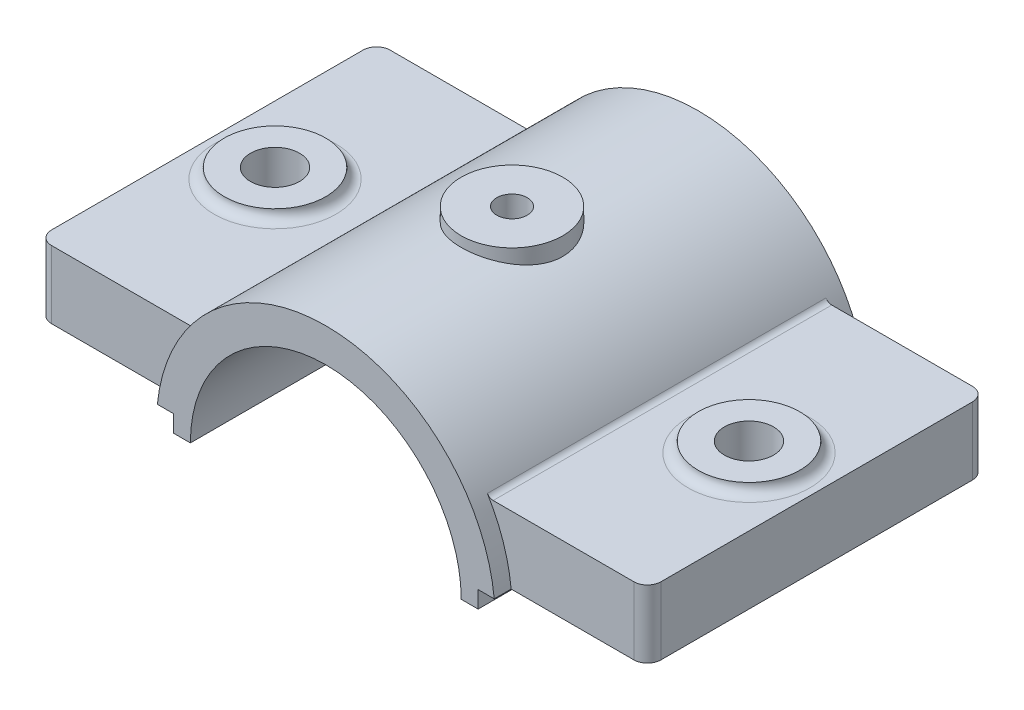
from build123d import *

# Parameters (mm, degrees)
BOSS_EXTRUDE1_DEPTH      = 50
BOSS_EXTRUDE2_START      = 5
BOSS_EXTRUDE2_DEPTH      = 5
SKETCH3_R                = 15
BOSS_EXTRUDE3_DEPTH      = 3
FILLET1_R                = 3
M16X1_5_TAPPED_HOLE1_D   = 14.5
BOSS_EXTRUDE6_REACH      = 120.042
BOSS_EXTRUDE6_END_RADIUS = 50
SKETCH11_R               = 15
M10X1_0_TAPPED_HOLE1_D   = 9
SKETCH15_R               = 8
CUT_EXTRUDE1_DEPTH       = 114.903467988
FILLET2_R                = 2
FILLET3_R                = 4


with BuildPart() as part:
    # Sketch1 → Boss-Extrude1 (new, symmetric)
    with BuildSketch(Plane.XY):
        with BuildLine():
            Line((-40, 0), (-45, 0))
            Line((-45, 0), (-45, 5))
            Line((-45, 5), (-90, 5))
            Line((-90, 5), (-90, 25))
            Line((-90, 25), (-43.301270189, 25))
            ThreePointArc((-43.301270189, 25), (0, 50), (43.301270189, 25))
            Line((43.301270189, 25), (90, 25))
            Line((90, 25), (90, 5))
            Line((90, 5), (45, 5))
            Line((45, 5), (45, 0))
            Line((45, 0), (40, 0))
            ThreePointArc((40, 0), (0, 40), (-40, 0))
        make_face()
    extrude(amount=BOSS_EXTRUDE1_DEPTH, both=True)

    # Sketch2 → Boss-Extrude2 (add)
    with BuildSketch(Plane.XY.offset(50).offset(BOSS_EXTRUDE2_START)):
        with BuildLine():
            Line((40, 0), (45, 0))
            Line((45, 0), (45, 5))
            Line((45, 5), (49.749371855, 5))
            ThreePointArc((49.749371855, 5), (0, 50), (-49.749371855, 5))
            Line((-49.749371855, 5), (-45, 5))
            Line((-45, 5), (-45, 0))
            Line((-45, 0), (-40, 0))
            ThreePointArc((-40, 0), (0, 40), (40, 0))
        make_face()
    boss_extrude2 = extrude(amount=-BOSS_EXTRUDE2_DEPTH)

    # Mirror1: Boss-Extrude2 across plane
    add(boss_extrude2.mirror(Plane.XY))

    # Sketch3 → Boss-Extrude3 (add)
    with BuildSketch(Plane(origin=(0, 25, 0), x_dir=(1, 0, 0), z_dir=(0, 1, 0))):
        with Locations(Location((-70, 0, 0), (0, 0, 270))):
            Circle(SKETCH3_R)
        with Locations(Location((70, 0, 0), (0, 0, 270))):
            Circle(SKETCH3_R)
    extrude(amount=BOSS_EXTRUDE3_DEPTH)

    # Fillet1
    fillet1_edges = [part.edges().sort_by_distance(p)[0] for p in [
        (-70, 25, -15),
        (70, 25, -15),
    ]]
    fillet(fillet1_edges, radius=FILLET1_R - 0.0001)  # a hair under: the kernel refuses the full size

    # M16x1.5 Tapped Hole1 (through all)
    with Locations(Plane(origin=(0, 28, 0), x_dir=(1, 0, 0), z_dir=(0, 1, 0))):
        with Locations((-70, 0), (70, 0)):
            Hole(M16X1_5_TAPPED_HOLE1_D / 2)

    # Boss-Extrude6: up to this cylinder (the profile starts outside it)
    boss_extrude6_end = Plane(origin=(0, 0, 0), z_dir=(0, 0, 1)) * Cylinder(BOSS_EXTRUDE6_END_RADIUS, 341.084, mode=Mode.PRIVATE)
    # Sketch11 → Boss-Extrude6 (add, up to the surface)
    with BuildSketch(Plane(origin=(0, 53, 0), x_dir=(-1, 0, 0), z_dir=(0, -1, 0)), mode=Mode.PRIVATE) as boss_extrude6_sk1:
        Circle(SKETCH11_R)
    boss_extrude6_tool1 = extrude(boss_extrude6_sk1.sketch, amount=BOSS_EXTRUDE6_REACH, mode=Mode.PRIVATE) - boss_extrude6_end
    add(boss_extrude6_tool1.solids().sort_by_distance((0, 53, 0))[0])

    # M10x1.0 Tapped Hole1 (through all)
    with Locations(Plane(origin=(0, 53, 0), x_dir=(1, 0, 0), z_dir=(0, 1, 0))):
        with Locations((0, 0)):
            Hole(M10X1_0_TAPPED_HOLE1_D / 2)

    # Sketch15 → Cut-Extrude1 (cut, through all)
    with BuildSketch(Plane(origin=(0, 43, 0), x_dir=(-1, 0, 0), z_dir=(0, -1, 0))):
        Circle(SKETCH15_R)
    extrude(amount=CUT_EXTRUDE1_DEPTH, mode=Mode.SUBTRACT)

    # Fillet2
    fillet2_edges = [part.edges().sort_by_distance(p)[0] for p in [
        (-43.301270189, 25, 0),
        (43.301270189, 25, 0),
    ]]
    fillet(fillet2_edges, radius=FILLET2_R)

    # Fillet3
    fillet3_edges = [part.edges().sort_by_distance(p)[0] for p in [
        (-90, 15, 50),
        (90, 15, 50),
        (90, 15, -50),
        (-90, 15, -50),
    ]]
    fillet(fillet3_edges, radius=FILLET3_R)


solid = part.part
